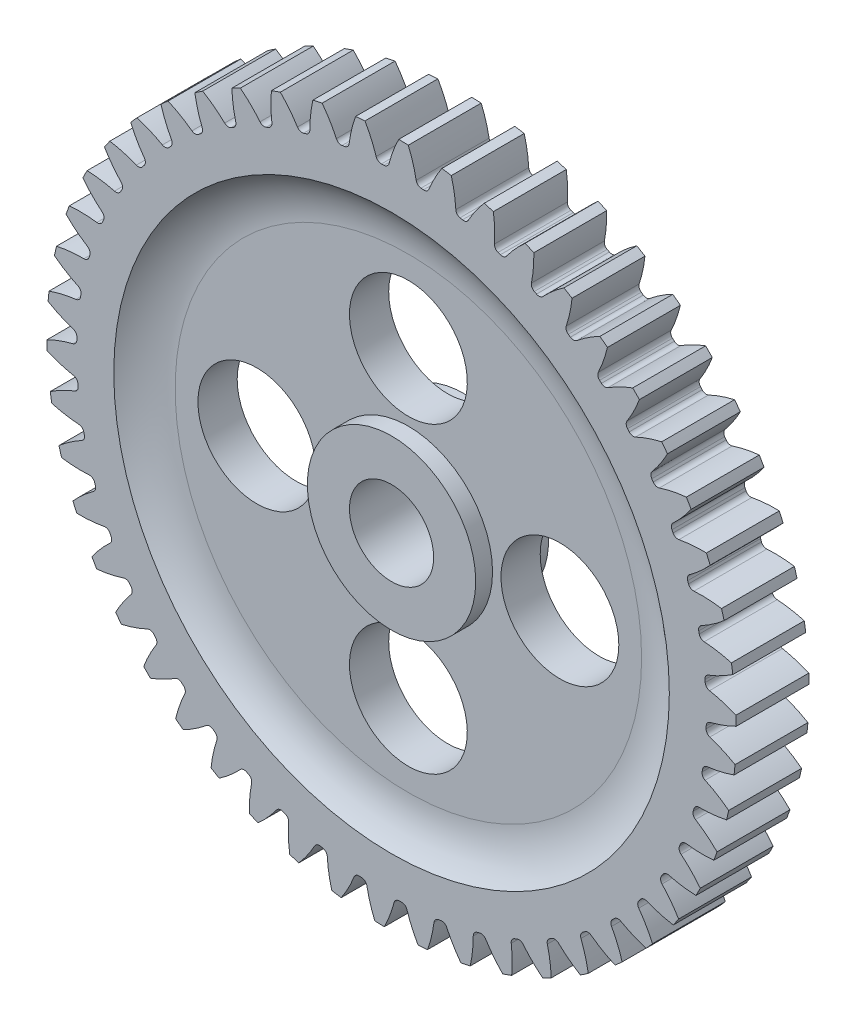
from build123d import *

# Parameters (mm, degrees)
SKETCH3_R          = 26
GEARBODY_DEPTH     = 5.499999998
TOOTHCUT_DEPTH     = 38.17862289
CIRPATTERN1_COUNT  = 50
BOREDIA_R          = 1.5875
BORE_DEPTH         = 12700
SKETCH4_R          = 20.955
SKETCH4_R_2        = 6.35
CUT_EXTRUDE1_DEPTH = 1.27
CUT_EXTRUDE2_START = -1.27
SKETCH5_R          = 20.955
SKETCH5_R_2        = 6.35
CUT_EXTRUDE2_DEPTH = 1.27
FILLET2_R          = 5.08
SKETCH6_R          = 4.445
CUT_EXTRUDE3_DEPTH = 38.006183625
CIRPATTERN2_COUNT  = 4
CUT_EXTRUDE4_REACH = 39.173
SKETCH7_R          = 3.175


with BuildPart() as part:
    # Sketch3 → gearBody (new body)
    with BuildSketch(Plane.XY):
        with Locations(Location((0, 0, 0), (0, 0, 180))):
            Circle(SKETCH3_R)
    extrude(amount=GEARBODY_DEPTH)

    # Sketch2 → toothCut (cut, through all)
    with BuildSketch(Plane.XY):
        with BuildLine():
            ThreePointArc((23.731397627, -0.91938419), (23.734871798, -0.824840213), (23.737969314, -0.730283147))
            ThreePointArc((23.737969314, -0.730283147), (23.82750333, -0.488292555), (24.044845282, -0.349230473))
            ThreePointArc((24.044845282, -0.349230473), (27.21103988, 1.092273746), (29.658276585, 3.564874635))
            ThreePointArc((29.658276585, 3.564874635), (29.853732217, -1.037484384), (29.339249323, -5.615171442))
            ThreePointArc((29.339249323, -5.615171442), (27.069566222, -2.978646974), (24.011080321, -1.320821097))
            ThreePointArc((24.011080321, -1.320821097), (23.803916493, -1.167006485), (23.731397627, -0.91938419))
        make_face()
    toothcut = extrude(amount=TOOTHCUT_DEPTH, mode=Mode.SUBTRACT)

    # CirPattern1: toothCut ×50 about axis
    cirpattern1_axis = Axis((0, 0, 0), (0, 0, 1))
    for i in range(1, CIRPATTERN1_COUNT):
        add(toothcut.rotate(cirpattern1_axis, i * 360 / CIRPATTERN1_COUNT), mode=Mode.SUBTRACT)

    # boreDia → bore (cut, symmetric)
    with BuildSketch(Plane.XY):
        Circle(BOREDIA_R)
    extrude(amount=BORE_DEPTH, both=True, mode=Mode.SUBTRACT)

    # Sketch4 → Cut-Extrude1 (cut)
    with BuildSketch(Plane.XY.offset(5.499999998)):
        Circle(SKETCH4_R)
        Circle(SKETCH4_R_2, mode=Mode.SUBTRACT)
    extrude(amount=-CUT_EXTRUDE1_DEPTH, mode=Mode.SUBTRACT)

    # Sketch5 → Cut-Extrude2 (cut)
    with BuildSketch(Plane(origin=(0, 0, 0), x_dir=(-1, 0, 0), z_dir=(0, 0, -1)).offset(CUT_EXTRUDE2_START)):
        with Locations(Location((0, 0, 0), (0, 0, 180))):
            Circle(SKETCH5_R)
        with Locations(Location((0, 0, 0), (0, 0, 180))):
            Circle(SKETCH5_R_2, mode=Mode.SUBTRACT)
    extrude(amount=CUT_EXTRUDE2_DEPTH, mode=Mode.SUBTRACT)

    # Fillet2
    # the kernel refuses this fillet: 5.08 mm, written as the material it adds along each edge
    with BuildSketch(Plane(origin=(0, 0, 4.229999998), x_dir=(1, 0, 0), z_dir=(0, -1, 0))) as fillet2_piece_1:
        with BuildLine():
            CenterArc((17.594895835, 5.08), FILLET2_R, 270, 41.409622109)
            Line((17.594895835, 0), (17.594895835, -0.1016))
            Line((17.594895835, -0.1016), (20.955, -0.1016))
            Line((20.955, -0.1016), (21.0566, 0))
            ThreePointArc((21.0566, 0), (21.0566, 0.635), (21.022202083, 1.1938))
            Line((21.022202083, 1.1938), (20.955, 1.27))
        make_face()
    revolve(axis=Axis((0, 0, 4.229999998), (0, 0, 1)))
    with BuildSketch(Plane(origin=(0, 0, 1.27), x_dir=(1, 0, 0), z_dir=(0, 1, 0))) as fillet2_piece_2:
        with BuildLine():
            CenterArc((17.594895835, 5.08), FILLET2_R, 270, 41.409622109)
            Line((17.594895835, 0), (17.594895835, -0.1016))
            Line((17.594895835, -0.1016), (20.955, -0.1016))
            Line((20.955, -0.1016), (21.0566, 0))
            ThreePointArc((21.0566, 0), (21.0566, 0.635), (21.022202083, 1.1938))
            Line((21.022202083, 1.1938), (20.955, 1.27))
        make_face()
    revolve(axis=Axis((0, 0, 1.27), (0, 0, -1)))

    # Sketch6 → Cut-Extrude3 (cut, through all)
    with BuildSketch(Plane.XY.offset(4.229999998)):
        with Locations((11.43, 0)):
            Circle(SKETCH6_R)
    cut_extrude3 = extrude(amount=-CUT_EXTRUDE3_DEPTH, mode=Mode.SUBTRACT)

    # CirPattern2: Cut-Extrude3 ×4 about axis
    cirpattern2_axis = Axis((0, 0, 0), (0, 0, 1))
    for i in range(1, CIRPATTERN2_COUNT):
        add(cut_extrude3.rotate(cirpattern2_axis, i * 360 / CIRPATTERN2_COUNT), mode=Mode.SUBTRACT)

    # Sketch7 → Cut-Extrude4 (cut, up to next)
    with BuildSketch(Plane.XY.offset(5.499999998), mode=Mode.PRIVATE) as cut_extrude4_sk1:
        Circle(SKETCH7_R)
    cut_extrude4_tool1 = extrude(cut_extrude4_sk1.sketch, amount=-CUT_EXTRUDE4_REACH, mode=Mode.PRIVATE) & part.part
    add(cut_extrude4_tool1.solids().sort_by_distance((0, 0, 5.5))[0], mode=Mode.SUBTRACT)


solid = part.part
